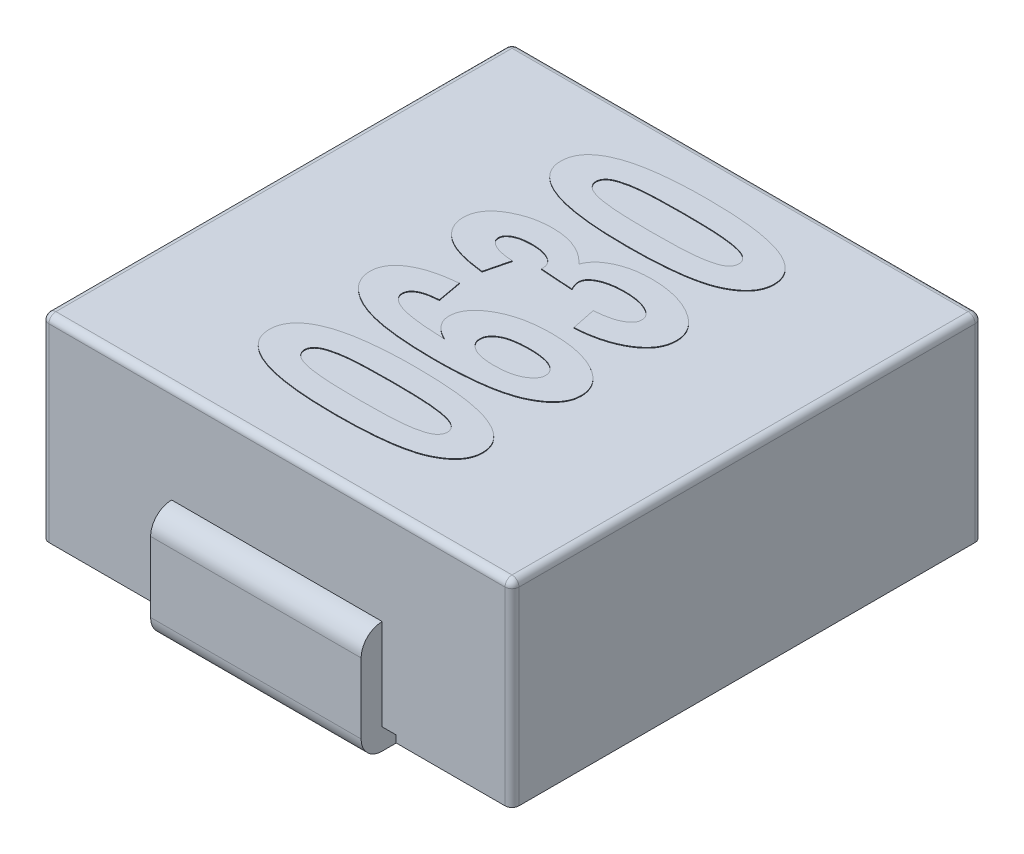
from build123d import *

# Parameters (mm, degrees)
EXTRUDE_1_DEPTH     = 2.8
SKETCH_2_W          = 3.4
SKETCH_2_H          = 2
CUT_EXTRUDE_1_DEPTH = 0.1
EXTRUDE_START       = -1.5
EXTRUDE_1_2_DEPTH   = 3
EXTRUDE_2_DEPTH     = 3
FILLET_1_R          = 0.1
EXTRUDE_2_2_DEPTH   = 0.01


# Read off the part's stored shape, not the designer's step: Вытянуть-Тонкостенный1, Вытянуть-Тонкостенный2
with BuildPart() as part:
    # Эскиз1 → Extrude 1 (new body)
    with BuildSketch(Plane(origin=(0, 0, 0), x_dir=(1, 0, 0), z_dir=(0, 1, 0))):
        with BuildLine():
            Line((-3.25, -3.35), (3.25, -3.35))
            ThreePointArc((3.25, -3.35), (3.320710678, -3.320710678), (3.35, -3.25))
            Line((3.35, -3.25), (3.35, 3.25))
            ThreePointArc((3.35, 3.25), (3.320710678, 3.320710678), (3.25, 3.35))
            Line((3.25, 3.35), (-3.25, 3.35))
            ThreePointArc((-3.25, 3.35), (-3.320710678, 3.320710678), (-3.35, 3.25))
            Line((-3.35, 3.25), (-3.35, -3.25))
            ThreePointArc((-3.35, -3.25), (-3.320710678, -3.320710678), (-3.25, -3.35))
        make_face()
    extrude(amount=EXTRUDE_1_DEPTH)

    # Эскиз2 → Вырез-Вытянуть1 (cut)
    with BuildSketch(Plane.XZ):
        with Locations((0, 2.35)):
            Rectangle(SKETCH_2_W, SKETCH_2_H)
        with Locations((0, -2.35)):
            Rectangle(SKETCH_2_W, SKETCH_2_H)
    extrude(amount=-CUT_EXTRUDE_1_DEPTH, mode=Mode.SUBTRACT)

    # Extrude 1 2 outline → Extrude 1 2 (add)
    with BuildSketch(Plane(origin=(0, 0, 0), x_dir=(0, 0, -1), z_dir=(1, 0, 0)).offset(EXTRUDE_START)):
        with BuildLine():
            Line((-3.35, -0.2), (-1.85, -0.2))
            Line((-1.85, -0.2), (-1.85, 0.1))
            Line((-1.85, 0.1), (-3.35, 0.1))
            Line((-3.35, 0.1), (-3.35, 1.4))
            ThreePointArc((-3.35, 1.4), (-3.562132034, 1.312132034), (-3.65, 1.1))
            Line((-3.65, 1.1), (-3.65, 0.1))
            ThreePointArc((-3.65, 0.1), (-3.562132034, -0.112132034), (-3.35, -0.2))
        make_face()
    extrude(amount=EXTRUDE_1_2_DEPTH)

    # Extrude 2 outline → Extrude 2 (add)
    with BuildSketch(Plane(origin=(0, 0, 0), x_dir=(0, 0, -1), z_dir=(1, 0, 0)).offset(EXTRUDE_START)):
        with BuildLine():
            Line((1.85, 0.1), (1.85, -0.2))
            Line((1.85, -0.2), (3.35, -0.2))
            ThreePointArc((3.35, -0.2), (3.562132034, -0.112132034), (3.65, 0.1))
            Line((3.65, 0.1), (3.65, 1.1))
            ThreePointArc((3.65, 1.1), (3.562132034, 1.312132034), (3.35, 1.4))
            Line((3.35, 1.4), (3.35, 0.1))
            Line((3.35, 0.1), (1.85, 0.1))
        make_face()
    extrude(amount=EXTRUDE_2_DEPTH)

    # Скругление1
    fillet_1_edges = [part.edges().sort_by_distance(p)[0] for p in [
        (3.320710678, 2.8, 3.320710678),
        (3.35, 2.8, 0),
        (3.320710678, 2.8, -3.320710678),
        (0, 2.8, -3.35),
        (-3.320710678, 2.8, -3.320710678),
        (-3.35, 2.8, 0),
        (-3.320710678, 2.8, 3.320710678),
        (0, 2.8, 3.35),
    ]]
    fillet(fillet_1_edges, radius=FILLET_1_R)

    # Эскиз4 → Extrude 2 2 (add)
    # profile 1 of 4: a face of its own
    with BuildSketch(Plane(origin=(0, 2.8, 0), x_dir=(1, 0, 0), z_dir=(0, 1, 0))):
        with BuildLine():
            add(Edge.make_bspline(
                [(-1.5, -1.957692308), (-1.499137143, -1.936566876), (-1.497447551, -1.895200382), (-1.482242122, -1.835098379), (-1.458087806, -1.778584119), (-1.423755807, -1.725761979), (-1.379856182, -1.676448664), (-1.325522016, -1.631842814), (-1.26298141, -1.589080556), (-1.216074382, -1.565892222), (-1.191706731, -1.553846154)],
                knots=[0, 0, 0, 0, 0.939629869, 1.83992419, 2.743264454, 3.666481804, 4.633505536, 5.672028627, 6.790646185, 8, 8, 8, 8], degree=3))
            add(Edge.make_bspline(
                [(-1.191706731, -1.553846154), (-1.158904384, -1.53955104), (-1.089763949, -1.509419953), (-0.974752135, -1.475847916), (-0.845845006, -1.445625948), (-0.701374134, -1.422391671), (-0.542246126, -1.402919805), (-0.367938846, -1.39061196), (-0.178780437, -1.381621929), (-0.047688732, -1.381060813), (0.020432692, -1.380769231)],
                knots=[0, 0, 0, 0, 0.695993191, 1.467006985, 2.327867947, 3.272915826, 4.313905632, 5.448135814, 6.673931191, 8, 8, 8, 8], degree=3))
            add(Edge.make_bspline(
                [(0.020432692, -1.380769231), (0.088346822, -1.38142732), (0.219213706, -1.382695421), (0.408266166, -1.390058637), (0.582217851, -1.404033081), (0.741553906, -1.421993189), (0.886013143, -1.446535154), (1.015745714, -1.476191084), (1.131109184, -1.510782717), (1.200752724, -1.540810484), (1.233774038, -1.555048077)],
                knots=[0, 0, 0, 0, 1.320779415, 2.545071084, 3.678366063, 4.713891943, 5.66240021, 6.526117529, 7.301162213, 8, 8, 8, 8], degree=3))
            add(Edge.make_bspline(
                [(1.233774038, -1.555048077), (1.257897503, -1.567159433), (1.304232457, -1.590422224), (1.366586207, -1.632149894), (1.419375705, -1.677271606), (1.462958308, -1.725975571), (1.497291664, -1.778447599), (1.520545201, -1.835248332), (1.53595582, -1.895181056), (1.537614479, -1.936560343), (1.538461538, -1.957692308)],
                knots=[0, 0, 0, 0, 1.209008214, 2.322193053, 3.353572777, 4.313995313, 5.243012364, 6.148517307, 7.054467326, 8, 8, 8, 8], degree=3))
            add(Edge.make_bspline(
                [(1.538461538, -1.957692308), (1.537411817, -1.978827802), (1.535332896, -2.02068559), (1.518925325, -2.081659932), (1.492824036, -2.139688165), (1.455493603, -2.194066787), (1.407742305, -2.245076498), (1.349426407, -2.292430364), (1.280976264, -2.336770497), (1.20193948, -2.378856542), (1.109155229, -2.416617895), (1.000326036, -2.447366483), (0.875989924, -2.475078094), (0.73501802, -2.496736352), (0.57803189, -2.514064356), (0.404573204, -2.525324635), (0.215024127, -2.533630888), (0.083143563, -2.534278123), (0.014423077, -2.534615385)],
                knots=[0, 0, 0, 0, 0.570946305, 1.130730606, 1.695682016, 2.284720325, 2.905752519, 3.57931678, 4.311109974, 5.108472247, 5.997836566, 7.014420583, 8.163245194, 9.441390503, 10.869501499, 12.433562194, 14.141596213, 16, 16, 16, 16], degree=3))
            add(Edge.make_bspline(
                [(0.014423077, -2.534615385), (-0.053091481, -2.533963284), (-0.183359594, -2.532705068), (-0.371596935, -2.525242226), (-0.545219308, -2.51161966), (-0.703981404, -2.492416926), (-0.848231491, -2.469095664), (-0.97745489, -2.439051032), (-1.092651154, -2.404620183), (-1.162292314, -2.374580012), (-1.1953125, -2.360336538)],
                knots=[0, 0, 0, 0, 1.316839064, 2.540817049, 3.673540427, 4.712565747, 5.659351526, 6.521795573, 7.299112968, 8, 8, 8, 8], degree=3))
            add(Edge.make_bspline(
                [(-1.1953125, -2.360336538), (-1.219440057, -2.348228581), (-1.265782873, -2.324972317), (-1.32808256, -2.283199756), (-1.381170251, -2.238132726), (-1.424095116, -2.188901849), (-1.459027623, -2.136872971), (-1.482048346, -2.080111905), (-1.497503564, -2.020209967), (-1.499156079, -1.978826439), (-1.5, -1.957692308)],
                knots=[0, 0, 0, 0, 1.209129629, 2.322426261, 3.353909562, 4.321163245, 5.242735491, 6.14833137, 7.05437237, 8, 8, 8, 8], degree=3))
        make_face()
        with BuildLine():
            add(Edge.make_bspline(
                [(-1, -1.957692308), (-0.999127679, -1.968216797), (-0.997360051, -1.989543107), (-0.98464763, -2.020189646), (-0.963752812, -2.048548502), (-0.934793713, -2.075564705), (-0.894910908, -2.09990752), (-0.842840464, -2.120448699), (-0.778433667, -2.137921563), (-0.731044768, -2.146944568), (-0.705528846, -2.151802885)],
                knots=[0, 0, 0, 0, 0.66053735, 1.338480494, 2.051183008, 2.861689582, 3.811811342, 4.969049189, 6.368024884, 8, 8, 8, 8], degree=3))
            add(Edge.make_bspline(
                [(-0.705528846, -2.151802885), (-0.686111734, -2.154704884), (-0.644159002, -2.160974962), (-0.576454743, -2.168853117), (-0.499229717, -2.1742951), (-0.413125803, -2.180127901), (-0.317716076, -2.183163637), (-0.213360006, -2.186421571), (-0.099564736, -2.188131724), (-0.020633397, -2.188348668), (0.020432692, -2.188461538)],
                knots=[0, 0, 0, 0, 0.647628605, 1.399270384, 2.247685976, 3.201110699, 4.24594481, 5.39623077, 6.6453211, 8, 8, 8, 8], degree=3))
            add(Edge.make_bspline(
                [(0.020432692, -2.188461538), (0.061297689, -2.188275136), (0.13962396, -2.187917856), (0.252024839, -2.187185067), (0.354384455, -2.183885271), (0.446927652, -2.18023517), (0.529543314, -2.176665945), (0.602017058, -2.17022466), (0.664624604, -2.164110466), (0.732465088, -2.153898049), (0.803572683, -2.140125262), (0.875380999, -2.120604957), (0.93178471, -2.099804879), (0.973513657, -2.07550215), (1.002243275, -2.048087616), (1.023951014, -2.020532594), (1.035633028, -1.989383166), (1.037524767, -1.968187963), (1.038461538, -1.957692308)],
                knots=[0, 0, 0, 0, 1.772229522, 3.396846643, 4.874325468, 6.213183949, 7.413572011, 8.459660885, 9.368179202, 10.14095794, 11.434081607, 12.506883432, 13.365124891, 14.035567992, 14.582591736, 15.079517174, 15.544185971, 16, 16, 16, 16], degree=3))
            add(Edge.make_bspline(
                [(1.038461538, -1.957692308), (1.037650183, -1.946944638), (1.036035603, -1.925557014), (1.022740293, -1.895014588), (1.002646122, -1.866265058), (0.972969063, -1.83991199), (0.933432472, -1.815419158), (0.881280735, -1.794956445), (0.816902053, -1.777456443), (0.769508703, -1.768437735), (0.743990385, -1.763581731)],
                knots=[0, 0, 0, 0, 0.672803919, 1.338864841, 2.061605897, 2.863308736, 3.813131099, 4.970004284, 6.368539142, 8, 8, 8, 8], degree=3))
            add(Edge.make_bspline(
                [(0.743990385, -1.763581731), (0.724572687, -1.760684675), (0.682815507, -1.754454644), (0.615519911, -1.746519364), (0.538893118, -1.741091016), (0.453191294, -1.735236285), (0.357980214, -1.732225337), (0.253624515, -1.728961702), (0.140029441, -1.727256369), (0.061298449, -1.727036962), (0.020432692, -1.726923077)],
                knots=[0, 0, 0, 0, 0.649769229, 1.397309303, 2.24191953, 3.191878681, 4.240166309, 5.394254338, 6.647473319, 8, 8, 8, 8], degree=3))
            add(Edge.make_bspline(
                [(0.020432692, -1.726923077), (-0.020432322, -1.727108707), (-0.098758626, -1.727464505), (-0.211359517, -1.728208719), (-0.313919908, -1.731488821), (-0.40666384, -1.735142837), (-0.489476366, -1.73875147), (-0.562156311, -1.745124382), (-0.62496015, -1.751282622), (-0.692610398, -1.761433922), (-0.763505543, -1.775316331), (-0.835258867, -1.79490132), (-0.892136546, -1.815562221), (-0.934274946, -1.839978234), (-0.963909922, -1.866874521), (-0.98462943, -1.895212168), (-0.997364372, -1.925837425), (-0.999129107, -1.947166469), (-1, -1.957692308)],
                knots=[0, 0, 0, 0, 1.769047239, 3.390747135, 4.874240912, 6.210695287, 7.408927887, 8.461780351, 9.368667298, 10.140058405, 11.422355672, 12.493231132, 13.358012728, 14.034682899, 14.587091034, 15.078019327, 15.545004449, 16, 16, 16, 16], degree=3))
        make_face(mode=Mode.SUBTRACT)
    # profile 2 of 4: a face of its own
    with BuildSketch(Plane(origin=(0, 2.8, 0), x_dir=(1, 0, 0), z_dir=(0, 1, 0))):
        with BuildLine():
            Line((-0.716947115, -0.034615385), (-0.653846154, -0.380769231))
            add(Edge.make_bspline(
                [(-0.653846154, -0.380769231), (-0.681547205, -0.382889175), (-0.733200789, -0.386842193), (-0.804831062, -0.399473341), (-0.865288637, -0.416090973), (-0.914169487, -0.438291327), (-0.952438737, -0.464341137), (-0.979725566, -0.494738618), (-0.996995203, -0.529605986), (-0.99898864, -0.554458508), (-1, -0.567067308)],
                knots=[0, 0, 0, 0, 1.549919711, 2.8901037, 4.054353795, 5.039938989, 5.874463713, 6.61920834, 7.299462416, 8, 8, 8, 8], degree=3))
            add(Edge.make_bspline(
                [(-1, -0.567067308), (-0.999654476, -0.575566657), (-0.99896188, -0.592603468), (-0.98950017, -0.617077399), (-0.976354433, -0.640877904), (-0.957197105, -0.663312067), (-0.932677568, -0.684107646), (-0.903627614, -0.704983619), (-0.868638664, -0.723635404), (-0.827958571, -0.742415177), (-0.778668125, -0.759259885), (-0.719275561, -0.774771817), (-0.648460203, -0.787425798), (-0.566873386, -0.799268821), (-0.474338721, -0.810310047), (-0.370650905, -0.818109574), (-0.255880051, -0.825624574), (-0.17549124, -0.828686016), (-0.133413462, -0.830288462)],
                knots=[0, 0, 0, 0, 0.421598826, 0.845088239, 1.292540369, 1.774895999, 2.30602329, 2.893820393, 3.555766604, 4.280231038, 5.127209864, 6.150050241, 7.339703188, 8.713347625, 10.262722907, 11.9871774, 13.89957508, 16, 16, 16, 16], degree=3))
            add(Edge.make_bspline(
                [(-0.133413462, -0.830288462), (-0.153226041, -0.819580375), (-0.19108179, -0.799120512), (-0.242718247, -0.764788806), (-0.286608857, -0.728348218), (-0.321502927, -0.688749083), (-0.350077859, -0.648240126), (-0.370205963, -0.605180581), (-0.381933675, -0.559868017), (-0.383717932, -0.529071749), (-0.384615385, -0.513581731)],
                knots=[0, 0, 0, 0, 1.267157945, 2.421149296, 3.485202224, 4.467489562, 5.383884497, 6.266713326, 7.128185226, 8, 8, 8, 8], degree=3))
            add(Edge.make_bspline(
                [(-0.384615385, -0.513581731), (-0.383753764, -0.496092925), (-0.382039735, -0.461302267), (-0.369774534, -0.40992183), (-0.348123112, -0.360966415), (-0.319073969, -0.313802855), (-0.28172485, -0.268656146), (-0.23557482, -0.226326612), (-0.181677232, -0.185291033), (-0.12020114, -0.146556207), (-0.052015436, -0.111758018), (0.020926011, -0.079830438), (0.099461039, -0.054651517), (0.182180379, -0.032638342), (0.270071765, -0.016824283), (0.362307799, -0.004782102), (0.459617513, 0.002554479), (0.526028935, 0.003408212), (0.560096154, 0.003846154)],
                knots=[0, 0, 0, 0, 0.712118958, 1.416625472, 2.136553801, 2.883795801, 3.66624321, 4.51480892, 5.428643096, 6.422356621, 7.469656695, 8.544188354, 9.661363121, 10.824973369, 12.028350145, 13.295373735, 14.612601657, 16, 16, 16, 16], degree=3))
            add(Edge.make_bspline(
                [(0.560096154, 0.003846154), (0.596168309, 0.003421893), (0.666384952, 0.002596043), (0.769063955, -0.004896221), (0.866298056, -0.016328939), (0.957852718, -0.034227442), (1.044263907, -0.05525344), (1.124753742, -0.082731392), (1.200519276, -0.113530758), (1.26974538, -0.150376182), (1.332843965, -0.189815334), (1.38725083, -0.23361695), (1.434194106, -0.279210116), (1.472474655, -0.328003059), (1.501748007, -0.38000015), (1.523067826, -0.434539702), (1.53609788, -0.492139584), (1.537668448, -0.531544161), (1.538461538, -0.551442308)],
                knots=[0, 0, 0, 0, 1.39498986, 2.71543254, 3.980142828, 5.179086445, 6.321625476, 7.416841902, 8.465806243, 9.481271331, 10.446328925, 11.339337795, 12.177594524, 12.972664813, 13.729001214, 14.477197864, 15.231029898, 16, 16, 16, 16], degree=3))
            add(Edge.make_bspline(
                [(1.538461538, -0.551442308), (1.537427146, -0.572777842), (1.535366803, -0.615274755), (1.518481686, -0.677481166), (1.490480293, -0.736422249), (1.45069746, -0.791763062), (1.401339194, -0.844850442), (1.340291423, -0.894127013), (1.268586086, -0.940394461), (1.186011794, -0.984335233), (1.090810257, -1.024609906), (0.981459802, -1.05696177), (0.859116341, -1.087065691), (0.722201649, -1.109467722), (0.571499521, -1.128453191), (0.406581412, -1.139980044), (0.228067882, -1.149182415), (0.104381233, -1.149720874), (0.040264423, -1.15)],
                knots=[0, 0, 0, 0, 0.582864578, 1.16097142, 1.749167969, 2.358718482, 3.017750106, 3.726302687, 4.498298734, 5.348834351, 6.281956375, 7.320036994, 8.464218828, 9.726176242, 11.111856478, 12.61750766, 14.246580185, 16, 16, 16, 16], degree=3))
            add(Edge.make_bspline(
                [(0.040264423, -1.15), (-0.025447276, -1.149345796), (-0.152311215, -1.148082781), (-0.335546367, -1.140643622), (-0.504560877, -1.126987543), (-0.659125219, -1.10779629), (-0.799750296, -1.084409689), (-0.926046606, -1.054514414), (-1.038405685, -1.019590677), (-1.136586221, -0.978467516), (-1.221972319, -0.933227902), (-1.296065858, -0.884767436), (-1.358167243, -0.832084508), (-1.410522361, -0.777569442), (-1.450234722, -0.718215697), (-1.478642787, -0.655712732), (-1.497291946, -0.589966759), (-1.49909323, -0.544754917), (-1.5, -0.521995192)],
                knots=[0, 0, 0, 0, 1.739098909, 3.357529062, 4.85223663, 6.225247106, 7.478570524, 8.623010299, 9.657512328, 10.588950926, 11.435634555, 12.211994303, 12.92677536, 13.586936376, 14.20596628, 14.806185805, 15.399031722, 16, 16, 16, 16], degree=3))
            add(Edge.make_bspline(
                [(-1.5, -0.521995192), (-1.499509835, -0.505912065), (-1.498544734, -0.474245452), (-1.48823713, -0.428027115), (-1.472908661, -0.383689243), (-1.45008245, -0.342235737), (-1.422204146, -0.30221565), (-1.386808754, -0.265294978), (-1.345917612, -0.229675703), (-1.298656162, -0.196710911), (-1.245690419, -0.165926024), (-1.186493628, -0.138726176), (-1.122305644, -0.113139062), (-1.051964992, -0.091975207), (-0.976507625, -0.072427191), (-0.894885635, -0.057345975), (-0.807953117, -0.043816558), (-0.74783237, -0.037738042), (-0.716947115, -0.034615385)],
                knots=[0, 0, 0, 0, 0.76381956, 1.50391014, 2.242342492, 2.988420858, 3.747230929, 4.55625529, 5.414143539, 6.323616016, 7.292829522, 8.324445395, 9.419800476, 10.577190305, 11.815979938, 13.12605627, 14.523596504, 16, 16, 16, 16], degree=3))
        make_face()
        with BuildLine():
            add(Edge.make_bspline(
                [(0.546875, -0.803846154), (0.583979099, -0.802982954), (0.653869542, -0.801357004), (0.752205069, -0.787904535), (0.837302066, -0.764872177), (0.908736182, -0.732952461), (0.964873214, -0.693863458), (1.006703356, -0.652463235), (1.033893336, -0.606715693), (1.036965076, -0.573993964), (1.038461538, -0.558052885)],
                knots=[0, 0, 0, 0, 1.487550157, 2.801996091, 3.96948146, 5.011955507, 5.923443518, 6.696061968, 7.364759143, 8, 8, 8, 8], degree=3))
            add(Edge.make_bspline(
                [(1.038461538, -0.558052885), (1.037247589, -0.542975729), (1.034821752, -0.512847031), (1.01275913, -0.470990618), (0.979139196, -0.433336895), (0.940843155, -0.407605158), (0.904366542, -0.388787238), (0.871658869, -0.37638195), (0.834963082, -0.36540953), (0.793808605, -0.357538593), (0.748802939, -0.349978418), (0.699405743, -0.345359083), (0.645851915, -0.343266067), (0.608775561, -0.342635026), (0.589543269, -0.342307692)],
                knots=[0, 0, 0, 0, 0.98415851, 1.96664515, 3.038345339, 4.2755351, 4.969759699, 5.731949388, 6.568604871, 7.481899529, 8.481065577, 9.564888458, 10.736856013, 12, 12, 12, 12], degree=3))
            add(Edge.make_bspline(
                [(0.589543269, -0.342307692), (0.569708839, -0.342582964), (0.531418978, -0.343114368), (0.476051528, -0.345911797), (0.424928736, -0.351378852), (0.377810294, -0.358615233), (0.33470023, -0.367193062), (0.295721336, -0.378754893), (0.260906126, -0.392429778), (0.221493613, -0.412585751), (0.180059321, -0.440438597), (0.143547098, -0.480900385), (0.119316595, -0.526029455), (0.11669742, -0.558569706), (0.115384615, -0.574879808)],
                knots=[0, 0, 0, 0, 1.22920971, 2.372957979, 3.434023047, 4.413685549, 5.326664308, 6.15541423, 6.929955182, 7.640580054, 8.897558011, 9.996505919, 10.995791649, 12, 12, 12, 12], degree=3))
            add(Edge.make_bspline(
                [(0.115384615, -0.574879808), (0.116603075, -0.590534425), (0.119054708, -0.622032703), (0.141364485, -0.666457866), (0.177501245, -0.705244394), (0.225416305, -0.741153975), (0.287618906, -0.769565278), (0.36277845, -0.789326477), (0.45050488, -0.801900588), (0.513373049, -0.803169801), (0.546875, -0.803846154)],
                knots=[0, 0, 0, 0, 0.695405127, 1.39920786, 2.165432477, 3.046964329, 4.054821068, 5.195738149, 6.505630974, 8, 8, 8, 8], degree=3))
        make_face(mode=Mode.SUBTRACT)
    # profile 3 of 4: a face of its own
    with BuildSketch(Plane(origin=(0, 2.8, 0), x_dir=(1, 0, 0), z_dir=(0, 1, 0))):
        with BuildLine():
            Line((0.647836538, 0.234615385), (0.576923077, 0.580769231))
            add(Edge.make_bspline(
                [(0.576923077, 0.580769231), (0.612265554, 0.583501262), (0.678697453, 0.588636557), (0.77124178, 0.605971909), (0.851211794, 0.626948628), (0.917443862, 0.655975382), (0.970309193, 0.689005147), (1.009397093, 0.725964443), (1.034254166, 0.767892221), (1.03708142, 0.798029115), (1.038461538, 0.812740385)],
                knots=[0, 0, 0, 0, 1.523447153, 2.86356515, 4.044691162, 5.070845881, 5.96228464, 6.71166558, 7.371101897, 8, 8, 8, 8], degree=3))
            add(Edge.make_bspline(
                [(1.038461538, 0.812740385), (1.036981649, 0.828492289), (1.033957386, 0.860682464), (1.006838979, 0.905204742), (0.964986856, 0.944645403), (0.907748709, 0.978387002), (0.838337926, 1.00806871), (0.756045905, 1.027448961), (0.663268438, 1.040292761), (0.597607112, 1.04161358), (0.563100962, 1.042307692)],
                knots=[0, 0, 0, 0, 0.653407149, 1.335285515, 2.116371688, 3.040580462, 4.094240927, 5.259113078, 6.559617015, 8, 8, 8, 8], degree=3))
            add(Edge.make_bspline(
                [(0.563100962, 1.042307692), (0.53040891, 1.041760291), (0.468604937, 1.040725434), (0.380965918, 1.029227401), (0.303894504, 1.010640895), (0.238146442, 0.984413885), (0.184813502, 0.953275732), (0.145358108, 0.917857777), (0.120256965, 0.877296172), (0.116988245, 0.848098415), (0.115384615, 0.833774038)],
                knots=[0, 0, 0, 0, 1.462861503, 2.765524062, 3.948827205, 5.003040426, 5.924358409, 6.69846313, 7.361467914, 8, 8, 8, 8], degree=3))
            add(Edge.make_bspline(
                [(0.115384615, 0.833774038), (0.115812426, 0.823701334), (0.116724288, 0.802231744), (0.126313987, 0.76916325), (0.13915943, 0.732938191), (0.151534893, 0.708843958), (0.158052885, 0.696153846)],
                knots=[0, 0, 0, 0, 0.829318464, 1.767660946, 2.824256753, 4, 4, 4, 4], degree=3))
            Line((0.158052885, 0.696153846), (-0.307692308, 0.727403846))
            add(Edge.make_bspline(
                [(-0.307692308, 0.727403846), (-0.307709723, 0.745818959), (-0.307743277, 0.781297667), (-0.327409522, 0.830982541), (-0.359821221, 0.873546968), (-0.406556221, 0.906548555), (-0.462459657, 0.93339075), (-0.527827949, 0.952379051), (-0.601365928, 0.963678064), (-0.653201713, 0.964798915), (-0.680288462, 0.965384615)],
                knots=[0, 0, 0, 0, 0.880596346, 1.696564192, 2.523146792, 3.426942696, 4.424544274, 5.502942066, 6.695164371, 8, 8, 8, 8], degree=3))
            add(Edge.make_bspline(
                [(-0.680288462, 0.965384615), (-0.703342584, 0.964744075), (-0.747189352, 0.963525826), (-0.809567197, 0.956187268), (-0.864666826, 0.942355777), (-0.912217397, 0.923819594), (-0.950444289, 0.89996642), (-0.979220785, 0.872515216), (-0.996968361, 0.839757753), (-0.998988866, 0.816144066), (-1, 0.804326923)],
                knots=[0, 0, 0, 0, 1.408975371, 2.679738345, 3.828641486, 4.871951251, 5.785399761, 6.564373782, 7.281560709, 8, 8, 8, 8], degree=3))
            add(Edge.make_bspline(
                [(-1, 0.804326923), (-0.998883111, 0.792438361), (-0.996601044, 0.768147247), (-0.975347807, 0.734939898), (-0.943524598, 0.70537348), (-0.900138502, 0.678369574), (-0.844834176, 0.656025975), (-0.778181447, 0.638474506), (-0.70054954, 0.625290619), (-0.644886518, 0.621329956), (-0.615384615, 0.619230769)],
                knots=[0, 0, 0, 0, 0.614593592, 1.255758524, 1.994293265, 2.872073712, 3.90185238, 5.092465769, 6.458980683, 8, 8, 8, 8], degree=3))
            Line((-0.615384615, 0.619230769), (-0.701923077, 0.273076923))
            add(Edge.make_bspline(
                [(-0.701923077, 0.273076923), (-0.745850282, 0.278690248), (-0.829379137, 0.289364149), (-0.947261336, 0.310652271), (-1.05133137, 0.336315118), (-1.142399575, 0.366107861), (-1.222404968, 0.401315606), (-1.292454138, 0.442837894), (-1.354091659, 0.490504136), (-1.40575896, 0.544691994), (-1.447922976, 0.603461625), (-1.477473501, 0.666886325), (-1.496727448, 0.73349699), (-1.498901597, 0.779355737), (-1.5, 0.802524038)],
                knots=[0, 0, 0, 0, 1.516545581, 2.883755412, 4.100129637, 5.184916199, 6.161561536, 7.087565235, 7.967299716, 8.821351288, 9.643645262, 10.432397742, 11.208031512, 12, 12, 12, 12], degree=3))
            add(Edge.make_bspline(
                [(-1.5, 0.802524038), (-1.499204626, 0.822222347), (-1.497629523, 0.861231514), (-1.484672518, 0.918058095), (-1.463352812, 0.971759406), (-1.433434711, 1.022149402), (-1.39485565, 1.069570555), (-1.347823632, 1.113752339), (-1.292569733, 1.155089953), (-1.251482231, 1.178566721), (-1.230168269, 1.190745192)],
                knots=[0, 0, 0, 0, 0.947568756, 1.876499546, 2.789879743, 3.719461166, 4.686463274, 5.723414899, 6.819031449, 8, 8, 8, 8], degree=3))
            add(Edge.make_bspline(
                [(-1.230168269, 1.190745192), (-1.192554527, 1.209451275), (-1.116930636, 1.247060581), (-0.994264244, 1.28419978), (-0.86484553, 1.30706807), (-0.77614172, 1.310025645), (-0.730769231, 1.311538462)],
                knots=[0, 0, 0, 0, 0.969902279, 1.95002621, 2.951427064, 4, 4, 4, 4], degree=3))
            add(Edge.make_bspline(
                [(-0.730769231, 1.311538462), (-0.698682949, 1.310704243), (-0.635881347, 1.30907145), (-0.544222225, 1.297083721), (-0.457535716, 1.276401761), (-0.375679037, 1.248316268), (-0.298619535, 1.212248694), (-0.22718542, 1.166981235), (-0.16001506, 1.114437929), (-0.120333222, 1.073253145), (-0.100360577, 1.052524038)],
                knots=[0, 0, 0, 0, 1.095736826, 2.144655767, 3.150308815, 4.134792802, 5.095793217, 6.048747144, 7.017896297, 8, 8, 8, 8], degree=3))
            add(Edge.make_bspline(
                [(-0.100360577, 1.052524038), (-0.095485456, 1.065099781), (-0.08567252, 1.090412987), (-0.064842669, 1.12560048), (-0.040419522, 1.159132255), (-0.012317586, 1.191027457), (0.020640138, 1.220699599), (0.057755518, 1.248129858), (0.099222083, 1.273365639), (0.1599429, 1.306009502), (0.244481184, 1.33947588), (0.354608379, 1.368350454), (0.474656044, 1.385002383), (0.557840448, 1.387280572), (0.600961538, 1.388461538)],
                knots=[0, 0, 0, 0, 0.588174819, 1.183913443, 1.778880718, 2.398610744, 3.036537093, 3.711935979, 4.411165352, 5.15479404, 6.720886317, 8.367571312, 10.117023395, 12, 12, 12, 12], degree=3))
            add(Edge.make_bspline(
                [(0.600961538, 1.388461538), (0.63282759, 1.388054708), (0.695457954, 1.387255114), (0.787610053, 1.379330613), (0.876040872, 1.365935743), (0.961222918, 1.348457288), (1.04218765, 1.323753389), (1.12039318, 1.296119568), (1.194175352, 1.261341533), (1.264244038, 1.222968389), (1.327678467, 1.179949851), (1.384716394, 1.135261448), (1.431419534, 1.086124133), (1.470877354, 1.035365196), (1.500893779, 0.981561195), (1.523325407, 0.925364861), (1.535995471, 0.86619108), (1.537636753, 0.825817561), (1.538461538, 0.805528846)],
                knots=[0, 0, 0, 0, 1.258720749, 2.473922433, 3.65023362, 4.791082452, 5.90538078, 6.991932887, 8.064795236, 9.124027415, 10.144685252, 11.090198737, 11.980125562, 12.815865701, 13.623750765, 14.405594193, 15.198770716, 16, 16, 16, 16], degree=3))
            add(Edge.make_bspline(
                [(1.538461538, 0.805528846), (1.537889365, 0.786230091), (1.536757143, 0.74804158), (1.524072959, 0.692441896), (1.50449447, 0.639431727), (1.478188819, 0.588389301), (1.442537924, 0.540701449), (1.399525776, 0.495622564), (1.349208949, 0.452697101), (1.291710527, 0.412904958), (1.228034383, 0.376203605), (1.158784929, 0.344216965), (1.08529176, 0.31505413), (1.006919655, 0.290555067), (0.923816512, 0.270159183), (0.836106948, 0.254098088), (0.743618444, 0.242025554), (0.680316625, 0.237128207), (0.647836538, 0.234615385)],
                knots=[0, 0, 0, 0, 0.797530121, 1.578158177, 2.346760491, 3.133004649, 3.945606798, 4.801914937, 5.707542233, 6.678205964, 7.692237657, 8.745640536, 9.832671599, 10.962893774, 12.141326967, 13.372401462, 14.651782352, 16, 16, 16, 16], degree=3))
        make_face()
    # profile 4 of 4: a face of its own
    with BuildSketch(Plane(origin=(0, 2.8, 0), x_dir=(1, 0, 0), z_dir=(0, 1, 0))):
        with BuildLine():
            add(Edge.make_bspline(
                [(-1.5, 2.196153846), (-1.499137143, 2.217279278), (-1.497447551, 2.258645772), (-1.482242122, 2.318747775), (-1.458087806, 2.375262035), (-1.423755807, 2.428084175), (-1.379856182, 2.47739749), (-1.325522016, 2.52200334), (-1.26298141, 2.564765598), (-1.216074382, 2.587953932), (-1.191706731, 2.6)],
                knots=[0, 0, 0, 0, 0.939629869, 1.83992419, 2.743264454, 3.666481804, 4.633505536, 5.672028627, 6.790646185, 8, 8, 8, 8], degree=3))
            add(Edge.make_bspline(
                [(-1.191706731, 2.6), (-1.158904384, 2.614295114), (-1.089763949, 2.644426201), (-0.974752135, 2.677998238), (-0.845845006, 2.708220205), (-0.701374134, 2.731454483), (-0.542246126, 2.750926349), (-0.367938846, 2.763234194), (-0.178780437, 2.772224225), (-0.047688732, 2.772785341), (0.020432692, 2.773076923)],
                knots=[0, 0, 0, 0, 0.695993191, 1.467006985, 2.327867947, 3.272915826, 4.313905632, 5.448135814, 6.673931191, 8, 8, 8, 8], degree=3))
            add(Edge.make_bspline(
                [(0.020432692, 2.773076923), (0.088346822, 2.772418834), (0.219213706, 2.771150733), (0.408266166, 2.763787517), (0.582217851, 2.749813073), (0.741553906, 2.731852965), (0.886013143, 2.707311), (1.015745714, 2.67765507), (1.131109184, 2.643063437), (1.200752724, 2.61303567), (1.233774038, 2.598798077)],
                knots=[0, 0, 0, 0, 1.320779415, 2.545071084, 3.678366063, 4.713891943, 5.66240021, 6.526117529, 7.301162213, 8, 8, 8, 8], degree=3))
            add(Edge.make_bspline(
                [(1.233774038, 2.598798077), (1.257897503, 2.586686721), (1.304232457, 2.56342393), (1.366586207, 2.52169626), (1.419375705, 2.476574548), (1.462958308, 2.427870583), (1.497291664, 2.375398555), (1.520545201, 2.318597822), (1.53595582, 2.258665098), (1.537614479, 2.217285811), (1.538461538, 2.196153846)],
                knots=[0, 0, 0, 0, 1.209008214, 2.322193053, 3.353572777, 4.313995313, 5.243012364, 6.148517307, 7.054467326, 8, 8, 8, 8], degree=3))
            add(Edge.make_bspline(
                [(1.538461538, 2.196153846), (1.537411817, 2.175018352), (1.535332896, 2.133160563), (1.518925325, 2.072186222), (1.492824036, 2.014157989), (1.455493603, 1.959779367), (1.407742305, 1.908769656), (1.349426407, 1.86141579), (1.280976264, 1.817075657), (1.20193948, 1.774989612), (1.109155229, 1.737228259), (1.000326036, 1.706479671), (0.875989924, 1.67876806), (0.73501802, 1.657109802), (0.57803189, 1.639781798), (0.404573204, 1.628521519), (0.215024127, 1.620215266), (0.083143563, 1.619568031), (0.014423077, 1.619230769)],
                knots=[0, 0, 0, 0, 0.570946305, 1.130730606, 1.695682016, 2.284720325, 2.905752519, 3.57931678, 4.311109974, 5.108472247, 5.997836566, 7.014420583, 8.163245194, 9.441390503, 10.869501499, 12.433562194, 14.141596213, 16, 16, 16, 16], degree=3))
            add(Edge.make_bspline(
                [(0.014423077, 1.619230769), (-0.053091481, 1.61988287), (-0.183359594, 1.621141086), (-0.371596935, 1.628603928), (-0.545219308, 1.642226494), (-0.703981404, 1.661429228), (-0.848231491, 1.68475049), (-0.97745489, 1.714795122), (-1.092651154, 1.749225971), (-1.162292314, 1.779266142), (-1.1953125, 1.793509615)],
                knots=[0, 0, 0, 0, 1.316839064, 2.540817049, 3.673540427, 4.712565747, 5.659351526, 6.521795573, 7.299112968, 8, 8, 8, 8], degree=3))
            add(Edge.make_bspline(
                [(-1.1953125, 1.793509615), (-1.219440057, 1.805617573), (-1.265782873, 1.828873837), (-1.32808256, 1.870646398), (-1.381170251, 1.915713428), (-1.424095116, 1.964944305), (-1.459027623, 2.016973183), (-1.482048346, 2.073734248), (-1.497503564, 2.133636187), (-1.499156079, 2.175019715), (-1.5, 2.196153846)],
                knots=[0, 0, 0, 0, 1.209129629, 2.322426261, 3.353909562, 4.321163245, 5.242735491, 6.14833137, 7.05437237, 8, 8, 8, 8], degree=3))
        make_face()
        with BuildLine():
            add(Edge.make_bspline(
                [(-1, 2.196153846), (-0.999127679, 2.185629357), (-0.997360051, 2.164303047), (-0.98464763, 2.133656508), (-0.963752812, 2.105297652), (-0.934793713, 2.078281449), (-0.894910908, 2.053938634), (-0.842840464, 2.033397455), (-0.778433667, 2.01592459), (-0.731044768, 2.006901586), (-0.705528846, 2.002043269)],
                knots=[0, 0, 0, 0, 0.66053735, 1.338480494, 2.051183008, 2.861689582, 3.811811342, 4.969049189, 6.368024884, 8, 8, 8, 8], degree=3))
            add(Edge.make_bspline(
                [(-0.705528846, 2.002043269), (-0.686111734, 1.99914127), (-0.644159002, 1.992871192), (-0.576454743, 1.984993036), (-0.499229717, 1.979551054), (-0.413125803, 1.973718253), (-0.317716076, 1.970682517), (-0.213360006, 1.967424583), (-0.099564736, 1.96571443), (-0.020633397, 1.965497486), (0.020432692, 1.965384615)],
                knots=[0, 0, 0, 0, 0.647628605, 1.399270384, 2.247685976, 3.201110699, 4.24594481, 5.39623077, 6.6453211, 8, 8, 8, 8], degree=3))
            add(Edge.make_bspline(
                [(0.020432692, 1.965384615), (0.061297689, 1.965571018), (0.13962396, 1.965928298), (0.252024839, 1.966661087), (0.354384455, 1.969960883), (0.446927652, 1.973610983), (0.529543314, 1.977180209), (0.602017058, 1.983621494), (0.664624604, 1.989735688), (0.732465088, 1.999948105), (0.803572683, 2.013720892), (0.875380999, 2.033241197), (0.93178471, 2.054041275), (0.973513657, 2.078344004), (1.002243275, 2.105758538), (1.023951014, 2.133313559), (1.035633028, 2.164462988), (1.037524767, 2.185658191), (1.038461538, 2.196153846)],
                knots=[0, 0, 0, 0, 1.772229522, 3.396846643, 4.874325468, 6.213183949, 7.413572011, 8.459660885, 9.368179202, 10.14095794, 11.434081607, 12.506883432, 13.365124891, 14.035567992, 14.582591736, 15.079517174, 15.544185971, 16, 16, 16, 16], degree=3))
            add(Edge.make_bspline(
                [(1.038461538, 2.196153846), (1.037650183, 2.206901516), (1.036035603, 2.22828914), (1.022740293, 2.258831566), (1.002646122, 2.287581096), (0.972969063, 2.313934164), (0.933432472, 2.338426996), (0.881280735, 2.358889709), (0.816902053, 2.37638971), (0.769508703, 2.385408419), (0.743990385, 2.390264423)],
                knots=[0, 0, 0, 0, 0.672803919, 1.338864841, 2.061605897, 2.863308736, 3.813131099, 4.970004284, 6.368539142, 8, 8, 8, 8], degree=3))
            add(Edge.make_bspline(
                [(0.743990385, 2.390264423), (0.724572687, 2.393161478), (0.682815507, 2.39939151), (0.615519911, 2.407326789), (0.538893118, 2.412755138), (0.453191294, 2.418609869), (0.357980214, 2.421620816), (0.253624515, 2.424884452), (0.140029441, 2.426589785), (0.061298449, 2.426809192), (0.020432692, 2.426923077)],
                knots=[0, 0, 0, 0, 0.649769229, 1.397309303, 2.24191953, 3.191878681, 4.240166309, 5.394254338, 6.647473319, 8, 8, 8, 8], degree=3))
            add(Edge.make_bspline(
                [(0.020432692, 2.426923077), (-0.020432322, 2.426737447), (-0.098758626, 2.426381649), (-0.211359517, 2.425637435), (-0.313919908, 2.422357332), (-0.40666384, 2.418703317), (-0.489476366, 2.415094684), (-0.562156311, 2.408721772), (-0.62496015, 2.402563531), (-0.692610398, 2.392412232), (-0.763505543, 2.378529823), (-0.835258867, 2.358944834), (-0.892136546, 2.338283933), (-0.934274946, 2.313867919), (-0.963909922, 2.286971633), (-0.98462943, 2.258633985), (-0.997364372, 2.228008729), (-0.999129107, 2.206679685), (-1, 2.196153846)],
                knots=[0, 0, 0, 0, 1.769047239, 3.390747135, 4.874240912, 6.210695287, 7.408927887, 8.461780351, 9.368667298, 10.140058405, 11.422355672, 12.493231132, 13.358012728, 14.034682899, 14.587091034, 15.078019327, 15.545004449, 16, 16, 16, 16], degree=3))
        make_face(mode=Mode.SUBTRACT)
    extrude(amount=EXTRUDE_2_2_DEPTH)


solid = part.part
